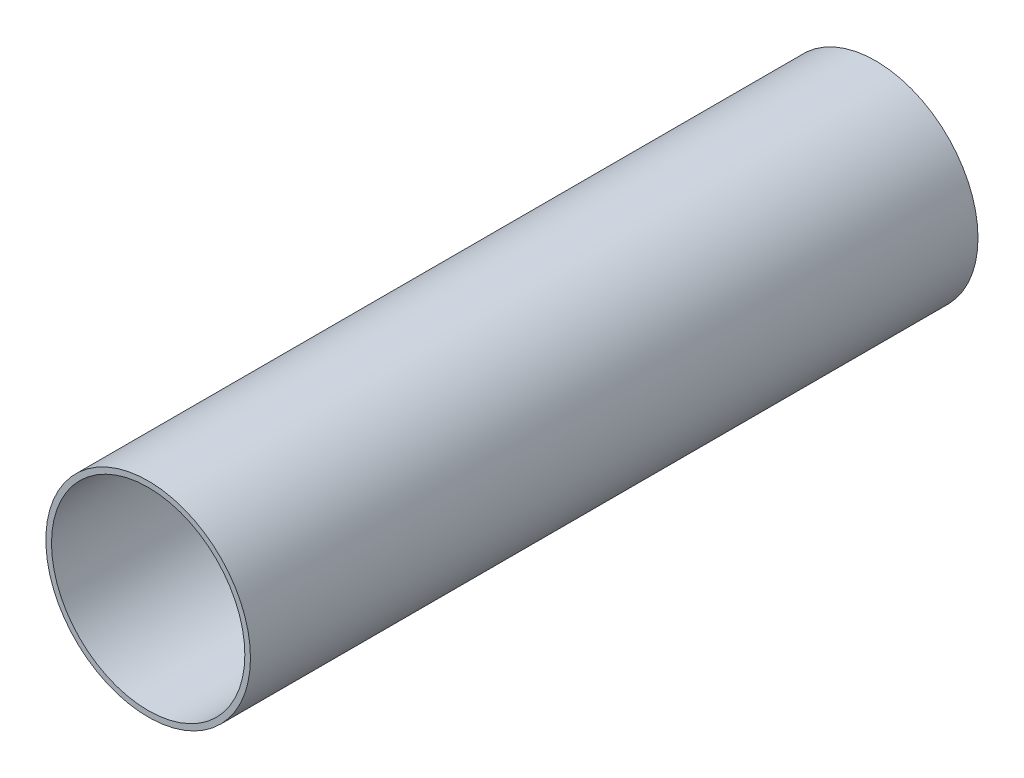
from build123d import *

# Parameters (mm, degrees)
SKETCH1_R           = 28.575
SKETCH1_R_2         = 27.0002
BOSS_EXTRUDE1_DEPTH = 101.6


with BuildPart() as part:
    # Sketch1 → Boss-Extrude1 (new, symmetric)
    with BuildSketch(Plane.XY):
        Circle(SKETCH1_R)
        Circle(SKETCH1_R_2, mode=Mode.SUBTRACT)
    extrude(amount=BOSS_EXTRUDE1_DEPTH, both=True)


solid = part.part
